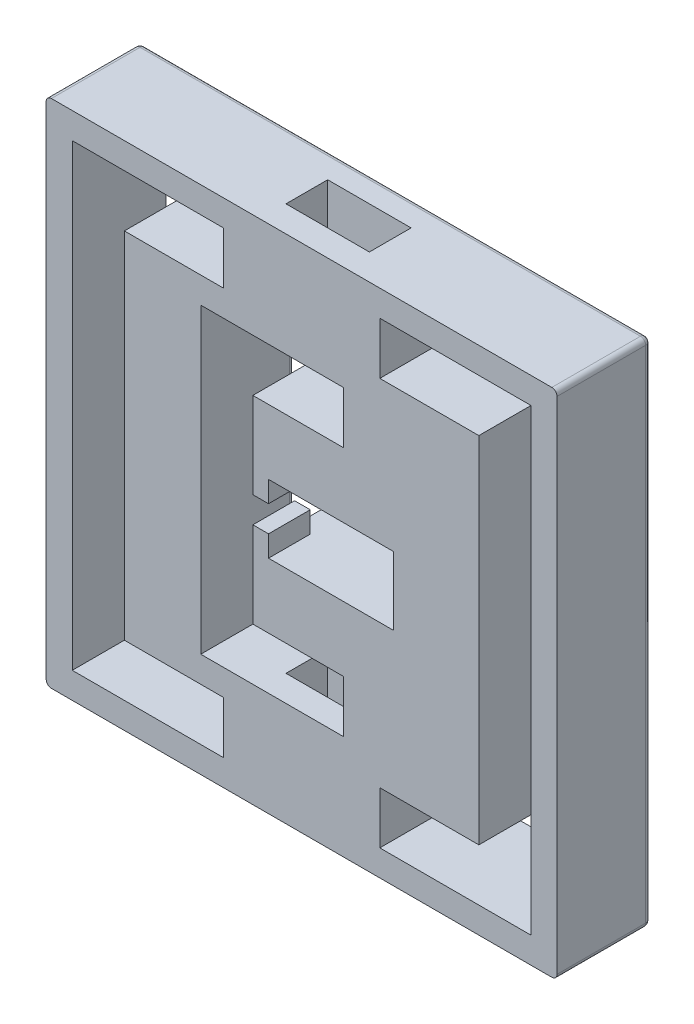
from build123d import *

# Parameters (mm, degrees)
SKETCH1_W           = 98
SKETCH1_H           = 98
BOSS_EXTRUDE1_DEPTH = 18
SKETCH2_W           = 24
SKETCH2_H           = 13.1
CUT_EXTRUDE1_DEPTH  = 18
SKETCH2_4_W         = 5.2
SKETCH2_4_H         = 12.7
SKETCH2_4_H_2       = 0.2
CUT_EXTRUDE2_DEPTH  = 10
CUT_EXTRUDE3_DEPTH  = 8
SKETCH5_W           = 10
SKETCH5_H           = 5
CUT_EXTRUDE4_DEPTH  = 18
SKETCH6_W           = 5
SKETCH6_H           = 20
BOSS_EXTRUDE2_DEPTH = 16
FILLET1_R           = 1
FILLET2_R           = 1
CUT_EXTRUDE5_DEPTH  = 18


with BuildPart() as part:
    # Sketch1 → Boss-Extrude1 (new body)
    with BuildSketch(Plane.XY):
        Rectangle(SKETCH1_W, SKETCH1_H)
    extrude(amount=BOSS_EXTRUDE1_DEPTH)

    # Sketch2 → Cut-Extrude1 (cut)
    with BuildSketch(Plane(origin=(0, 0, 0), x_dir=(-1, 0, 0), z_dir=(0, 0, -1))):
        with Locations((-5.65, 0)):
            Rectangle(SKETCH2_W, SKETCH2_H)
    extrude(amount=-CUT_EXTRUDE1_DEPTH, mode=Mode.SUBTRACT)

    # Sketch2<4> → Cut-Extrude2 (cut)
    with BuildSketch(Plane(origin=(0, 0, 0), x_dir=(-1, 0, 0), z_dir=(0, 0, -1))):
        with Locations((-20.25, 0)):
            Rectangle(SKETCH2_4_W, SKETCH2_4_H)
        Polygon((-22.85, 6.35), (-17.65, 6.35), (-17.65, 6.55), (-22.85, 6.55), (-23.05, 6.55), (-23.05, 6.35), (-23.05, -6.55), (-17.65, -6.55), (-17.65, -6.35), (-22.85, -6.35), align=None)
        Polygon((11.55, 6.35), (6.35, 6.35), (6.35, 0), (6.35, -6.15), (11.55, -6.15), align=None)
        Polygon((6.35, 6.55), (6.35, 6.35), (11.55, 6.35), (11.55, -6.15), (11.55, -6.35), (6.35, -6.35), (6.35, -6.55), (11.55, -6.55), (11.75, -6.55), (11.75, -6.35), (11.75, 6.55), align=None)
        with Locations((8.95, -6.25)):
            Rectangle(SKETCH2_4_W, SKETCH2_4_H_2)
    extrude(amount=-CUT_EXTRUDE2_DEPTH, mode=Mode.SUBTRACT)

    # Sketch4 → Cut-Extrude3 (cut)
    with BuildSketch(Plane(origin=(0, 0, 10), x_dir=(-1, 0, 0), z_dir=(0, 0, -1))):
        Polygon((6.35, 0), (6.35, 2.5), (9.35, 2.5), (9.35, -2.5), (6.35, -2.5), align=None)
    extrude(amount=-CUT_EXTRUDE3_DEPTH, mode=Mode.SUBTRACT)

    # Sketch5 → Cut-Extrude4 (cut)
    with BuildSketch(Plane.XY.offset(18)):
        with Locations((-14.35, 0)):
            Rectangle(SKETCH5_W, SKETCH5_H)
        Polygon((-19.35, 2.5), (-9.35, 2.5), (-9.35, 19), (8, 19), (8, 29), (8, 49), (0, 49), (-8, 49), (-8, 29), (-19.35, 29), align=None)
        Polygon((-9.35, -19), (-9.35, -2.5), (-19.35, -2.5), (-19.35, -29), (-8, -29), (-8, -49), (0, -49), (8, -49), (8, -29), (8, -19), align=None)
    extrude(amount=-CUT_EXTRUDE4_DEPTH, mode=Mode.SUBTRACT)


with BuildPart() as cut_extrude4_piece_1:
    # of the separate pieces the step leaves, piece 1, a body of its own (cut_extrude4_pieces)
    add(part.part.solids().sort_by_distance((8, 49, 0))[0])



with BuildPart() as cut_extrude4_piece_2:
    # of the separate pieces the step leaves, piece 2, a body of its own (cut_extrude4_pieces)
    add(part.part.solids().sort_by_distance((-49, 49, 0))[0])


with BuildPart() as cut_extrude4_piece_1_1:
    add(cut_extrude4_piece_1.part)

    add(cut_extrude4_piece_2.part)  # Boss-Extrude2 merges Cut-Extrude4 piece 2
    # Sketch6 → Boss-Extrude2 (add)
    with BuildSketch(Plane(origin=(-8, 0, 0), x_dir=(0, 0, -1), z_dir=(1, 0, 0))):
        with Locations((-15.5, 39)):
            Rectangle(SKETCH6_W, SKETCH6_H)
        with Locations((-2.5, 39)):
            Rectangle(SKETCH6_W, SKETCH6_H)
        with Locations((-15.5, -39)):
            Rectangle(SKETCH6_W, SKETCH6_H)
        with Locations((-2.5, -39)):
            Rectangle(SKETCH6_W, SKETCH6_H)
    extrude(amount=BOSS_EXTRUDE2_DEPTH)

    # Fillet1
    fillet1_edges = [cut_extrude4_piece_1_1.edges().sort_by_distance(p)[0] for p in [
        (-19.35, 0, 0),
        (-5.675, 29, 0),
        (-5.675, -29, 0),
        (-0.675, -19, 0),
        (-9.35, -12.775, 0),
        (6.85, -6.55, 0),
        (6.85, 6.55, 0),
        (-9.35, 12.775, 0),
        (49, 0, 0),
        (23.05, 0, 0),
        (-0.675, 19, 0),
        (8, 24, 0),
        (8, -24, 0),
        (0, -49, 0),
        (-49, 0, 0),
        (0, 49, 0),
    ]]
    fillet(fillet1_edges, radius=FILLET1_R)

    # Fillet2
    # the kernel refuses this fillet: 1 mm, written as the material it takes off along each edge
    with BuildSketch(Plane(origin=(48, -48, 1), x_dir=(0, -1, 0), z_dir=(1, 0, 0))) as fillet2_piece_1_section:
        Polygon((0, 0), (FILLET2_R, 0), (FILLET2_R, FILLET2_R), (0, FILLET2_R), align=None)
    fillet2_piece_1 = extrude(amount=FILLET2_R, mode=Mode.PRIVATE)
    fillet2_piece_1 = fillet2_piece_1 - Plane(origin=(48, -48, 1), x_dir=(0, 0.7071067811865475, 0.7071067811865475), z_dir=(1, 0, 0)) * Sphere(FILLET2_R, mode=Mode.PRIVATE)
    add(fillet2_piece_1, mode=Mode.SUBTRACT)
    with BuildSketch(Plane(origin=(-48, -48, 1), x_dir=(0, -1, 0), z_dir=(-1, 0, 0))) as fillet2_piece_2_section:
        Polygon((0, 0), (FILLET2_R, 0), (FILLET2_R, -FILLET2_R), (0, -FILLET2_R), align=None)
    fillet2_piece_2 = extrude(amount=FILLET2_R, mode=Mode.PRIVATE)
    fillet2_piece_2 = fillet2_piece_2 - Plane(origin=(-48, -48, 1), x_dir=(0, 0.7071067811865475, 0.7071067811865475), z_dir=(-1, 0, 0)) * Sphere(FILLET2_R, mode=Mode.PRIVATE)
    add(fillet2_piece_2, mode=Mode.SUBTRACT)
    with BuildSketch(Plane(origin=(48, 48, 1), x_dir=(1, 0, 0), z_dir=(0, 1, 0))) as fillet2_piece_3_section:
        Polygon((0, 0), (FILLET2_R, 0), (FILLET2_R, FILLET2_R), (0, FILLET2_R), align=None)
    fillet2_piece_3 = extrude(amount=FILLET2_R, mode=Mode.PRIVATE)
    fillet2_piece_3 = fillet2_piece_3 - Plane(origin=(48, 48, 1), x_dir=(-0.7071067811865475, 0, 0.7071067811865475), z_dir=(0, 1, 0)) * Sphere(FILLET2_R, mode=Mode.PRIVATE)
    add(fillet2_piece_3, mode=Mode.SUBTRACT)
    with BuildSketch(Plane(origin=(-48, 48, 1), x_dir=(-1, 0, 0), z_dir=(0, 1, 0))) as fillet2_piece_4_section:
        Polygon((0, 0), (FILLET2_R, 0), (FILLET2_R, -FILLET2_R), (0, -FILLET2_R), align=None)
    fillet2_piece_4 = extrude(amount=FILLET2_R, mode=Mode.PRIVATE)
    fillet2_piece_4 = fillet2_piece_4 - Plane(origin=(-48, 48, 1), x_dir=(0.7071067811865475, 0, 0.7071067811865475), z_dir=(0, 1, 0)) * Sphere(FILLET2_R, mode=Mode.PRIVATE)
    add(fillet2_piece_4, mode=Mode.SUBTRACT)
    with BuildSketch(Plane(origin=(49, 49, 1), x_dir=(-1, 0, 0), z_dir=(0, 0, 1)), Plane(origin=(49, -49, 1), x_dir=(0, 1, 0), z_dir=(0, 0, 1))) as fillet2_piece_5:
        with BuildLine():
            CenterArc((FILLET2_R, FILLET2_R), FILLET2_R, 180, 90)
            Line((0, FILLET2_R), (0, 0))
            Line((0, 0), (FILLET2_R, 0))
        make_face()
    extrude(amount=19.5, mode=Mode.SUBTRACT)
    with BuildSketch(Plane(origin=(-49, -49, 1), x_dir=(0, 1, 0), z_dir=(0, 0, 1)), Plane(origin=(-49, 49, 1), x_dir=(1, 0, 0), z_dir=(0, 0, 1))) as fillet2_piece_6:
        with BuildLine():
            CenterArc((FILLET2_R, -FILLET2_R), FILLET2_R, 90, 90)
            Line((0, -FILLET2_R), (0, 0))
            Line((0, 0), (FILLET2_R, 0))
        make_face()
    extrude(amount=19.5, mode=Mode.SUBTRACT)

    # Sketch8 → Cut-Extrude5 (cut)
    with BuildSketch(Plane.XY.offset(18)):
        Polygon((-15, -34), (-34, -34), (-34, 34), (-15, 34), (-15, 44), (-44, 44), (-44, -44), (-15, -44), align=None)
        Polygon((34, -34), (15, -34), (15, -44), (44, -44), (44, 44), (15, 44), (15, 34), (34, 34), align=None)
    extrude(amount=-CUT_EXTRUDE5_DEPTH, mode=Mode.SUBTRACT)


solid = cut_extrude4_piece_1_1.part
